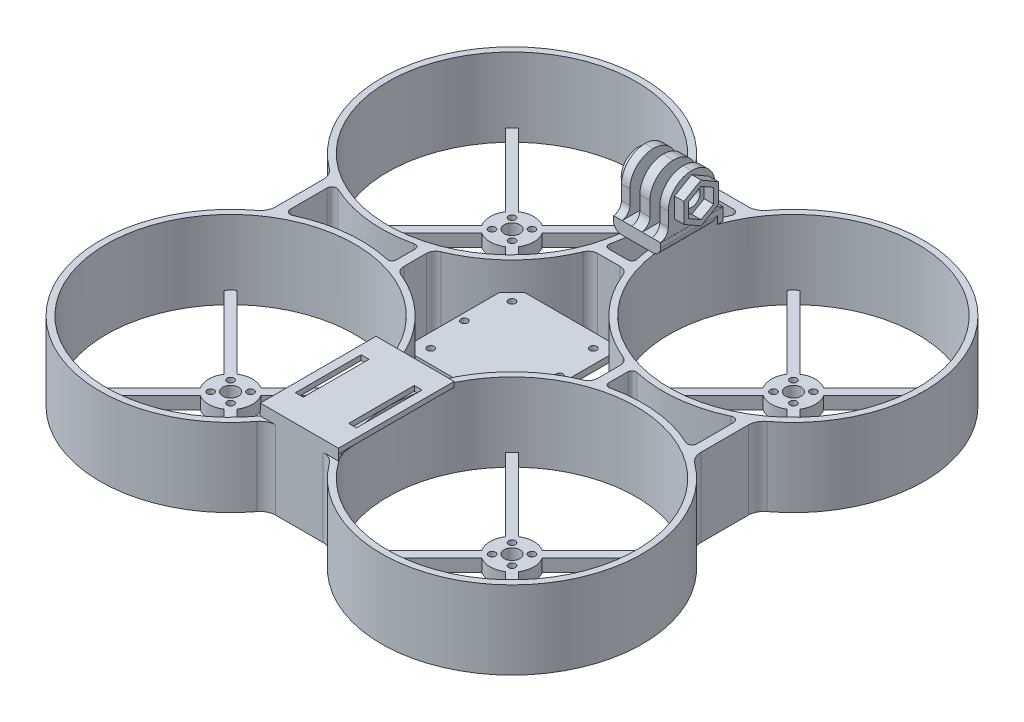
from build123d import *

# Parameters (mm, degrees)
SKETCH1_R               = 7
SKETCH1_R_2             = 1.1
SKETCH1_R_3             = 2.5
BOSS_EXTRUDE3_DEPTH     = 4
BOSS_EXTRUDE3_2_DEPTH   = 4
BOSS_EXTRUDE3_3_DEPTH   = 4
BOSS_EXTRUDE3_4_DEPTH   = 4
SKETCH10_R              = 41.75
SKETCH10_R_2            = 39.75
BOSS_EXTRUDE8_DEPTH     = 25
BOSS_EXTRUDE8_2_DEPTH   = 25
BOSS_EXTRUDE8_3_DEPTH   = 25
BOSS_EXTRUDE8_4_DEPTH   = 25
BOSS_EXTRUDE15_DEPTH    = 25
BOSS_EXTRUDE16_DEPTH    = 4
SKETCH13_R              = 1.1
BOSS_EXTRUDE9_DEPTH     = 2
SKETCH14_W              = 15
SKETCH14_H              = 20
BOSS_EXTRUDE10_DEPTH    = 4
SKETCH15_W              = 3.25
SKETCH15_H              = 15
SKETCH15_W_2            = 2.7
BOSS_EXTRUDE11_DEPTH    = 15
FILLET10_R              = 7.5
CUT_EXTRUDE1_DEPTH      = 12
CUT_EXTRUDE1_DEPTH_BACK = 17
SKETCH16_R              = 2.7
BOSS_EXTRUDE12_START    = 2.1
SKETCH17_R              = 5.5
SKETCH17_R_2            = 2.7
BOSS_EXTRUDE12_DEPTH    = 2.1
BOSS_EXTRUDE17_DEPTH    = 3
FILLET12_R              = 2.5
FILLET11_R              = 3
SKETCH24_W              = 25
SKETCH24_H              = 37
SKETCH24_W_2            = 2.5
SKETCH24_H_2            = 21
BOSS_EXTRUDE18_DEPTH    = 1.6
FILLET14_R              = 5
FILLET15_R              = 1.5
FILLET16_R              = 3
FILLET17_R              = 1.3


# Some blends are built 0.0001 mm under size
with BuildPart() as part:
    # Sketch1 → Boss-Extrude3 (new body)
    with BuildSketch(Plane(origin=(0, 0, 0), x_dir=(1, 0, 0), z_dir=(0, 1, 0))):
        with Locations(Location((-45, 45, 0), (0, 0, 270))):
            Circle(SKETCH1_R)
        with Locations(Location((-48.174434414, 48.189508763, 0), (0, 0, 270))):
            Circle(SKETCH1_R_2, mode=Mode.SUBTRACT)
        with Locations(Location((-41.818028411, 48.181971589, 0), (0, 0, 270))):
            Circle(SKETCH1_R_2, mode=Mode.SUBTRACT)
        with Locations(Location((-41.810491237, 41.825565586, 0), (0, 0, 270))):
            Circle(SKETCH1_R_2, mode=Mode.SUBTRACT)
        with Locations(Location((-48.181971589, 41.818028411, 0), (0, 0, 270))):
            Circle(SKETCH1_R_2, mode=Mode.SUBTRACT)
        with Locations(Location((-45, 45, 0), (0, 0, 270))):
            Circle(SKETCH1_R_3, mode=Mode.SUBTRACT)
    extrude(amount=BOSS_EXTRUDE3_DEPTH)



with BuildPart() as body_2:
    # Sketch1 → Boss-Extrude3 2 (new body)
    with BuildSketch(Plane(origin=(0, 0, 0), x_dir=(1, 0, 0), z_dir=(0, 1, 0))):
        with Locations(Location((45, 45, 0), (0, 0, 270))):
            Circle(SKETCH1_R)
        with Locations(Location((41.818019485, 48.181980515, 0), (0, 0, 270))):
            Circle(SKETCH1_R_2, mode=Mode.SUBTRACT)
        with Locations(Location((48.181980515, 48.181980515, 0), (0, 0, 270))):
            Circle(SKETCH1_R_2, mode=Mode.SUBTRACT)
        with Locations(Location((48.181980515, 41.818019485, 0), (0, 0, 270))):
            Circle(SKETCH1_R_2, mode=Mode.SUBTRACT)
        with Locations(Location((41.818019485, 41.818019485, 0), (0, 0, 270))):
            Circle(SKETCH1_R_2, mode=Mode.SUBTRACT)
        with Locations(Location((45, 45, 0), (0, 0, 270))):
            Circle(SKETCH1_R_3, mode=Mode.SUBTRACT)
    extrude(amount=BOSS_EXTRUDE3_2_DEPTH)


with BuildPart() as body_3:
    # Sketch1 → Boss-Extrude3 3 (new body)
    with BuildSketch(Plane(origin=(0, 0, 0), x_dir=(1, 0, 0), z_dir=(0, 1, 0))):
        with Locations(Location((45, -45, 0), (0, 0, 270))):
            Circle(SKETCH1_R)
        with Locations(Location((41.818019485, -48.181980515, 0), (0, 0, 270))):
            Circle(SKETCH1_R_2, mode=Mode.SUBTRACT)
        with Locations(Location((41.818019485, -41.818019485, 0), (0, 0, 270))):
            Circle(SKETCH1_R_2, mode=Mode.SUBTRACT)
        with Locations(Location((48.181980515, -41.818019485, 0), (0, 0, 270))):
            Circle(SKETCH1_R_2, mode=Mode.SUBTRACT)
        with Locations(Location((48.181980515, -48.181980515, 0), (0, 0, 270))):
            Circle(SKETCH1_R_2, mode=Mode.SUBTRACT)
        with Locations(Location((45, -45, 0), (0, 0, 270))):
            Circle(SKETCH1_R_3, mode=Mode.SUBTRACT)
    extrude(amount=BOSS_EXTRUDE3_3_DEPTH)


with BuildPart() as body_4:
    # Sketch1 → Boss-Extrude3 4 (new body)
    with BuildSketch(Plane(origin=(0, 0, 0), x_dir=(1, 0, 0), z_dir=(0, 1, 0))):
        with Locations(Location((-45, -45, 0), (0, 0, 270))):
            Circle(SKETCH1_R)
        with Locations(Location((-48.181980515, -41.818019485, 0), (0, 0, 270))):
            Circle(SKETCH1_R_2, mode=Mode.SUBTRACT)
        with Locations(Location((-41.818019485, -41.818019485, 0), (0, 0, 270))):
            Circle(SKETCH1_R_2, mode=Mode.SUBTRACT)
        with Locations(Location((-41.818019485, -48.181980515, 0), (0, 0, 270))):
            Circle(SKETCH1_R_2, mode=Mode.SUBTRACT)
        with Locations(Location((-48.181980515, -48.181980515, 0), (0, 0, 270))):
            Circle(SKETCH1_R_2, mode=Mode.SUBTRACT)
        with Locations(Location((-45, -45, 0), (0, 0, 270))):
            Circle(SKETCH1_R_3, mode=Mode.SUBTRACT)
    extrude(amount=BOSS_EXTRUDE3_4_DEPTH)


with BuildPart() as body_5:
    # Sketch10 → Boss-Extrude8 (new body)
    with BuildSketch(Plane(origin=(0, 0, 0), x_dir=(1, 0, 0), z_dir=(0, 1, 0))):
        with Locations(Location((-45, -45, 0), (0, 0, 270))):
            Circle(SKETCH10_R)
        with Locations(Location((-45, -45, 0), (0, 0, 270))):
            Circle(SKETCH10_R_2, mode=Mode.SUBTRACT)
    extrude(amount=BOSS_EXTRUDE8_DEPTH)



with BuildPart() as body_6:
    # Sketch10 → Boss-Extrude8 2 (new body)
    with BuildSketch(Plane(origin=(0, 0, 0), x_dir=(1, 0, 0), z_dir=(0, 1, 0))):
        with Locations(Location((45, -45, 0), (0, 0, 270))):
            Circle(SKETCH10_R)
        with Locations(Location((45, -45, 0), (0, 0, 270))):
            Circle(SKETCH10_R_2, mode=Mode.SUBTRACT)
    extrude(amount=BOSS_EXTRUDE8_2_DEPTH)


with BuildPart() as body_7:
    # Sketch10 → Boss-Extrude8 3 (new body)
    with BuildSketch(Plane(origin=(0, 0, 0), x_dir=(1, 0, 0), z_dir=(0, 1, 0))):
        with Locations(Location((45, 45, 0), (0, 0, 270))):
            Circle(SKETCH10_R)
        with Locations(Location((45, 45, 0), (0, 0, 270))):
            Circle(SKETCH10_R_2, mode=Mode.SUBTRACT)
    extrude(amount=BOSS_EXTRUDE8_3_DEPTH)


with BuildPart() as body_8:
    # Sketch10 → Boss-Extrude8 4 (new body)
    with BuildSketch(Plane(origin=(0, 0, 0), x_dir=(1, 0, 0), z_dir=(0, 1, 0))):
        with Locations(Location((-45, 45, 0), (0, 0, 270))):
            Circle(SKETCH10_R)
        with Locations(Location((-45, 45, 0), (0, 0, 270))):
            Circle(SKETCH10_R_2, mode=Mode.SUBTRACT)
    extrude(amount=BOSS_EXTRUDE8_4_DEPTH)


with BuildPart() as body_5_1:
    add(body_5.part)

    add(body_6.part)  # Boss-Extrude15 merges body 6

    add(body_7.part)  # Boss-Extrude15 merges body 7

    add(body_8.part)  # Boss-Extrude15 merges body 8
    # Sketch21 → Boss-Extrude15 (add)
    with BuildSketch(Plane(origin=(0, 25, 0), x_dir=(1, 0, 0), z_dir=(0, 1, 0))):
        Polygon((-34, 4.725162943), (-34, -4.725162943), (-31, -5.667284609), (-31, 5.667284609), align=None)
        Polygon((-68, 10.156600338), (-68, -10.156600338), (-65, -8.352182875), (-65, 8.352182875), align=None)
        Polygon((-10.156600338, 68), (-8.352182875, 65), (8.352182875, 65), (10.156600338, 68), align=None)
        Polygon((-5.667284609, 31), (-4.725162943, 34), (4.725162943, 34), (5.667284609, 31), align=None)
        Polygon((68, 10.156600338), (65, 8.352182875), (65, -8.352182875), (68, -10.156600338), align=None)
        Polygon((31, 5.667284609), (34, 4.725162943), (34, -4.725162943), (31, -5.667284609), align=None)
        Polygon((10.156600338, -68), (8.352182875, -65), (-8.352182875, -65), (-10.156600338, -68), align=None)
        Polygon((5.667284609, -31), (4.725162943, -34), (-4.725162943, -34), (-5.667284609, -31), align=None)
    extrude(amount=-BOSS_EXTRUDE15_DEPTH)


with BuildPart() as part_1:
    add(part.part)

    add(body_2.part)  # Boss-Extrude16 merges body 2

    add(body_3.part)  # Boss-Extrude16 merges body 3

    add(body_4.part)  # Boss-Extrude16 merges body 4

    add(body_5_1.part)  # Boss-Extrude16 merges body 5
    # Sketch22 → Boss-Extrude16 (add)
    with BuildSketch(Plane(origin=(0, 0, 0), x_dir=(1, 0, 0), z_dir=(0, 1, 0))):
        Polygon((-39.104569927, 41.22589027), (-15.242783205, 17.364103549), (-17.364103549, 15.242783205), (-41.22589027, 39.104569927), align=None)
        Polygon((-48.77410973, 39.104569927), (-50.895430073, 41.22589027), (-74.757216795, 17.364103549), (-72.635896451, 15.242783205), align=None)
        Polygon((-50.895430073, 48.77410973), (-48.77410973, 50.895430073), (-72.635896451, 74.757216795), (-74.757216795, 72.635896451), align=None)
        Polygon((-41.22589027, 50.895430073), (-39.104569927, 48.77410973), (-15.242783205, 72.635896451), (-17.364103549, 74.757216795), align=None)
        Polygon((48.77410973, 50.895430073), (50.895430073, 48.77410973), (74.757216795, 72.635896452), (72.635896451, 74.757216795), align=None)
        Polygon((39.104569927, 48.77410973), (41.22589027, 50.895430073), (17.364103549, 74.757216795), (15.242783205, 72.635896452), align=None)
        Polygon((50.895430073, 41.22589027), (48.77410973, 39.104569927), (72.635896451, 15.242783205), (74.757216795, 17.364103549), align=None)
        Polygon((41.22589027, 39.104569927), (39.104569927, 41.22589027), (15.242783205, 17.364103549), (17.364103549, 15.242783205), align=None)
        Polygon((50.895430073, -48.77410973), (48.77410973, -50.895430073), (72.635896452, -74.757216795), (74.757216795, -72.635896451), align=None)
        Polygon((48.77410973, -39.104569927), (50.895430073, -41.22589027), (74.757216795, -17.364103548), (72.635896452, -15.242783205), align=None)
        Polygon((41.22589027, -50.895430073), (39.104569927, -48.77410973), (15.242783205, -72.635896451), (17.364103549, -74.757216795), align=None)
        Polygon((39.104569927, -41.22589027), (41.22589027, -39.104569927), (17.364103549, -15.242783205), (15.242783205, -17.364103548), align=None)
        Polygon((-48.77410973, -50.895430073), (-50.895430073, -48.77410973), (-74.757216795, -72.635896451), (-72.635896451, -74.757216795), align=None)
        Polygon((-39.104569927, -48.77410973), (-41.22589027, -50.895430073), (-17.364103548, -74.757216795), (-15.242783205, -72.635896451), align=None)
        Polygon((-50.895430073, -41.22589027), (-48.77410973, -39.104569927), (-72.635896451, -15.242783205), (-74.757216795, -17.364103548), align=None)
        Polygon((-41.22589027, -39.104569927), (-39.104569927, -41.22589027), (-15.242783205, -17.364103549), (-17.364103548, -15.242783205), align=None)
    extrude(amount=BOSS_EXTRUDE16_DEPTH)

    # Sketch13 → Boss-Extrude9 (add)
    with BuildSketch(Plane(origin=(0, 14, 0), x_dir=(1, 0, 0), z_dir=(0, 1, 0))):
        with BuildLine():
            Line((-14.5, -17.5), (14.5, -17.5))
            ThreePointArc((14.5, -17.5), (16.621320344, -16.621320344), (17.5, -14.5))
            Line((17.5, -14.5), (17.5, 14.5))
            ThreePointArc((17.5, 14.5), (16.621320344, 16.621320344), (14.5, 17.5))
            Line((14.5, 17.5), (-14.5, 17.5))
            ThreePointArc((-14.5, 17.5), (-16.621320344, 16.621320344), (-17.5, 14.5))
            Line((-17.5, 14.5), (-17.5, -14.5))
            ThreePointArc((-17.5, -14.5), (-16.621320344, -16.621320344), (-14.5, -17.5))
        make_face()
        with Locations(Location((-13, 13, 0), (0, 0, 270))):
            Circle(SKETCH13_R, mode=Mode.SUBTRACT)
        with Locations(Location((13, 13, 0), (0, 0, 270))):
            Circle(SKETCH13_R, mode=Mode.SUBTRACT)
        with Locations(Location((13, -13, 0), (0, 0, 270))):
            Circle(SKETCH13_R, mode=Mode.SUBTRACT)
        with Locations(Location((-13, -13, 0), (0, 0, 270))):
            Circle(SKETCH13_R, mode=Mode.SUBTRACT)
        with Locations(Location((-15.25, 0, 0), (0, 0, 270))):
            Circle(SKETCH13_R, mode=Mode.SUBTRACT)
        with Locations(Location((15.25, 0, 0), (0, 0, 270))):
            Circle(SKETCH13_R, mode=Mode.SUBTRACT)
    extrude(amount=BOSS_EXTRUDE9_DEPTH)

    # Sketch14 → Boss-Extrude10 (add)
    with BuildSketch(Plane(origin=(0, 25, 0), x_dir=(1, 0, 0), z_dir=(0, 1, 0))):
        with Locations((0, 50)):
            Rectangle(SKETCH14_W, SKETCH14_H)
    extrude(amount=BOSS_EXTRUDE10_DEPTH)

    # Sketch15 → Boss-Extrude11 (add)
    with BuildSketch(Plane(origin=(0, 29, 0), x_dir=(1, 0, 0), z_dir=(0, 1, 0))):
        with Locations((0, 50)):
            Rectangle(SKETCH15_W, SKETCH15_H)
        with Locations((-6.125, 50)):
            Rectangle(SKETCH15_W_2, SKETCH15_H)
        with Locations((6.125, 50)):
            Rectangle(SKETCH15_W_2, SKETCH15_H)
    extrude(amount=BOSS_EXTRUDE11_DEPTH)

    # Fillet10
    fillet10_edges = [part_1.edges().sort_by_distance(p)[0] for p in [
        (6.125, 44, -42.5),
        (6.125, 44, -57.5),
        (0, 44, -42.5),
        (0, 44, -57.5),
        (-6.125, 44, -42.5),
        (-6.125, 44, -57.5),
    ]]
    fillet(fillet10_edges, radius=FILLET10_R - 0.0001)  # a hair under: the kernel refuses the full size

    # Sketch16 → Cut-Extrude1 (cut, two sides: drawn at the far end of the back side and taken through both)
    with BuildSketch(Plane.ZY.offset(7.475).offset(-CUT_EXTRUDE1_DEPTH_BACK)):
        with Locations(Location((-50, 36.5, 0), (0, 0, 180))):
            Circle(SKETCH16_R)
    extrude(amount=CUT_EXTRUDE1_DEPTH + CUT_EXTRUDE1_DEPTH_BACK, mode=Mode.SUBTRACT)

    # Sketch17 → Boss-Extrude12 (add)
    with BuildSketch(Plane.ZY.offset(7.475).offset(BOSS_EXTRUDE12_START)):
        with Locations(Location((-50, 36.5, 0), (0, 0, 180))):
            Circle(SKETCH17_R)
        with Locations(Location((-50, 36.5, 0), (0, 0, 180))):
            Circle(SKETCH17_R_2, mode=Mode.SUBTRACT)
    extrude(amount=-BOSS_EXTRUDE12_DEPTH)

    # Sketch23 → Boss-Extrude17 (add)
    with BuildSketch(Plane(origin=(7.475, 0, 0), x_dir=(0, 0, -1), z_dir=(1, 0, 0))):
        Polygon((50, 42.850852961), (44.5, 39.675426481), (44.5, 33.324573519), (50, 30.149147039), (55.5, 33.324573519), (55.5, 39.675426481), align=None)
        Polygon((50, 41.118802154), (46, 38.809401077), (46, 34.190598923), (50, 31.881197846), (54, 34.190598923), (54, 38.809401077), align=None, mode=Mode.SUBTRACT)
    extrude(amount=BOSS_EXTRUDE17_DEPTH)

    # Fillet12
    # the kernel refuses this fillet: 2.5 mm, written as the material it takes off along each edge
    with BuildSketch(Plane(origin=(-7.5, 25, -64.433796873), x_dir=(0, 1, 0), z_dir=(0, 0, 1))) as fillet12_piece_1_section:
        with BuildLine():
            CenterArc((FILLET12_R, -FILLET12_R), FILLET12_R, 90, 90)
            Line((0, -FILLET12_R), (0, 0))
            Line((0, 0), (FILLET12_R, 0))
        make_face()
    fillet12_piece_1 = extrude(amount=30.683796873, mode=Mode.PRIVATE)
    fillet12_piece_1 = fillet12_piece_1 & Plane(origin=(-45, 25.587737679, -45), x_dir=(0, 0, 1), z_dir=(0, -1, 0)) * Cylinder(39.75, 72, mode=Mode.PRIVATE)
    with BuildSketch(Plane(origin=(7.5, 25, -33.75), x_dir=(0, 1, 0), z_dir=(0, 0, -1))) as fillet12_piece_2_section:
        with BuildLine():
            CenterArc((FILLET12_R, -FILLET12_R), FILLET12_R, 90, 90)
            Line((0, -FILLET12_R), (0, 0))
            Line((0, 0), (FILLET12_R, 0))
        make_face()
    fillet12_piece_2 = extrude(amount=30.683796873, mode=Mode.PRIVATE)
    fillet12_piece_2 = fillet12_piece_2 & Plane(origin=(45, 25.587748778, -45), x_dir=(0, 0, 1), z_dir=(0, -1, 0)) * Cylinder(39.75, 72, mode=Mode.PRIVATE)
    add([fillet12_piece_1, fillet12_piece_2], mode=Mode.SUBTRACT)

    # Fillet11
    # the kernel refuses this fillet: 3 mm, written as the material it adds along each edge
    with BuildSketch(Plane(origin=(9.020099729, 29, -57.5), x_dir=(0, 0, -1), z_dir=(-1, 0, 0))) as fillet11_piece_1_section:
        with BuildLine():
            CenterArc((3, -2.958039892), FILLET11_R, 99.594068227, 80.405931773)
            Line((0, -2.958039892), (-0.06, -2.958039892))
            Line((-0.06, -2.958039892), (-0.06, 0))
            Line((-0.06, 0), (0, 0.06))
            ThreePointArc((0, 0.06), (1.25, 0.06), (2.49, 0.059160798))
            Line((2.49, 0.059160798), (2.5, 0))
        make_face()
    fillet11_piece_1 = extrude(amount=10.645099729, mode=Mode.PRIVATE)
    fillet11_piece_1 = split(fillet11_piece_1, bisect_by=Plane(origin=(7.475, 29.68598203, -58.116958935), z_dir=(-1, 0, 0)), keep=Keep.TOP, mode=Mode.PRIVATE)
    fillet11_piece_1 = split(fillet11_piece_1, bisect_by=Plane(origin=(4.775, 29.68598203, -58.116958935), z_dir=(1, 0, 0)), keep=Keep.TOP, mode=Mode.PRIVATE)
    add(fillet11_piece_1)
    with BuildSketch(Plane(origin=(1.625, 29, -57.5), x_dir=(0, 0, -1), z_dir=(-1, 0, 0)), Plane(origin=(-1.625, 29, -42.5), x_dir=(0, 0, 1), z_dir=(1, 0, 0))) as fillet11_piece_2:
        with BuildLine():
            CenterArc((3, -2.958039892), FILLET11_R, 99.594068227, 80.405931773)
            Line((0, -2.958039892), (-0.06, -2.958039892))
            Line((-0.06, -2.958039892), (-0.06, 0))
            Line((-0.06, 0), (0, 0.06))
            ThreePointArc((0, 0.06), (1.25, 0.06), (2.49, 0.059160798))
            Line((2.49, 0.059160798), (2.5, 0))
        make_face()
    extrude(amount=3.25)
    with BuildSketch(Plane(origin=(1.625, 29, -57.5), x_dir=(0, 0, -1), z_dir=(-1, 0, 0))) as fillet11_piece_3_section:
        with BuildLine():
            CenterArc((3, -2.958039892), FILLET11_R, 99.594068227, 80.405931773)
            Line((0, -2.958039892), (-0.06, -2.958039892))
            Line((-0.06, -2.958039892), (-0.06, 0))
            Line((-0.06, 0), (0, 0.06))
            ThreePointArc((0, 0.06), (1.25, 0.06), (2.49, 0.059160798))
            Line((2.49, 0.059160798), (2.5, 0))
        make_face()
    fillet11_piece_3 = extrude(amount=10.645099729, mode=Mode.PRIVATE)
    fillet11_piece_3 = split(fillet11_piece_3, bisect_by=Plane(origin=(-4.775, 29.68598203, -58.116958935), z_dir=(-1, 0, 0)), keep=Keep.TOP, mode=Mode.PRIVATE)
    fillet11_piece_3 = split(fillet11_piece_3, bisect_by=Plane(origin=(-7.475, 29.68598203, -58.116958935), z_dir=(1, 0, 0)), keep=Keep.TOP, mode=Mode.PRIVATE)
    add(fillet11_piece_3)
    with BuildSketch(Plane(origin=(-9.020099729, 29, -42.5), x_dir=(0, 0, 1), z_dir=(1, 0, 0))) as fillet11_piece_4_section:
        with BuildLine():
            CenterArc((3, -2.958039892), FILLET11_R, 99.594068227, 80.405931773)
            Line((0, -2.958039892), (-0.06, -2.958039892))
            Line((-0.06, -2.958039892), (-0.06, 0))
            Line((-0.06, 0), (0, 0.06))
            ThreePointArc((0, 0.06), (1.25, 0.06), (2.49, 0.059160798))
            Line((2.49, 0.059160798), (2.5, 0))
        make_face()
    fillet11_piece_4 = extrude(amount=10.645099729, mode=Mode.PRIVATE)
    fillet11_piece_4 = split(fillet11_piece_4, bisect_by=Plane(origin=(-7.475, 29.68598203, -41.883041065), z_dir=(1, 0, 0)), keep=Keep.TOP, mode=Mode.PRIVATE)
    fillet11_piece_4 = split(fillet11_piece_4, bisect_by=Plane(origin=(-4.775, 29.68598203, -41.883041065), z_dir=(-1, 0, 0)), keep=Keep.TOP, mode=Mode.PRIVATE)
    add(fillet11_piece_4)
    with BuildSketch(Plane(origin=(-1.625, 29, -42.5), x_dir=(0, 0, 1), z_dir=(1, 0, 0))) as fillet11_piece_5_section:
        with BuildLine():
            CenterArc((3, -2.958039892), FILLET11_R, 99.594068227, 80.405931773)
            Line((0, -2.958039892), (-0.06, -2.958039892))
            Line((-0.06, -2.958039892), (-0.06, 0))
            Line((-0.06, 0), (0, 0.06))
            ThreePointArc((0, 0.06), (1.25, 0.06), (2.49, 0.059160798))
            Line((2.49, 0.059160798), (2.5, 0))
        make_face()
    fillet11_piece_5 = extrude(amount=10.645099729, mode=Mode.PRIVATE)
    fillet11_piece_5 = split(fillet11_piece_5, bisect_by=Plane(origin=(7.475, 29.68598203, -41.883041065), z_dir=(-1, 0, 0)), keep=Keep.TOP, mode=Mode.PRIVATE)
    fillet11_piece_5 = split(fillet11_piece_5, bisect_by=Plane(origin=(4.775, 29.68598203, -41.883041065), z_dir=(1, 0, 0)), keep=Keep.TOP, mode=Mode.PRIVATE)
    add(fillet11_piece_5)
    with BuildSketch(Plane(origin=(2.620099729, 29, -57.5), x_dir=(0, 1, 0), z_dir=(-1, 0, 0))) as fillet11_piece_6_section:
        with BuildLine():
            CenterArc((2.958039892, 3), FILLET11_R, 189.594068227, 80.405931773)
            Line((0, 2.5), (-0.059160798, 2.49))
            ThreePointArc((-0.059160798, 2.49), (-0.06, 1.25), (-0.06, 0))
            Line((-0.06, 0), (0, -0.06))
            Line((0, -0.06), (2.958039892, -0.06))
            Line((2.958039892, -0.06), (2.958039892, 0))
        make_face()
    fillet11_piece_6 = extrude(amount=10.095099729, mode=Mode.PRIVATE)
    fillet11_piece_6 = split(fillet11_piece_6, bisect_by=Plane(origin=(-1.625, 29.68598203, -58.116958935), z_dir=(1, 0, 0)), keep=Keep.TOP, mode=Mode.PRIVATE)
    fillet11_piece_6 = split(fillet11_piece_6, bisect_by=Plane(origin=(1.625, 29.68598203, -58.116958935), z_dir=(-1, 0, 0)), keep=Keep.TOP, mode=Mode.PRIVATE)
    add(fillet11_piece_6)
    with BuildSketch(Plane(origin=(-4.775, 29, -57.5), x_dir=(0, 1, 0), z_dir=(-1, 0, 0)), Plane(origin=(-7.475, 29, -42.5), x_dir=(0, 1, 0), z_dir=(1, 0, 0))) as fillet11_piece_7:
        with BuildLine():
            CenterArc((2.958039892, 3), FILLET11_R, 189.594068227, 80.405931773)
            Line((0, 2.5), (-0.059160798, 2.49))
            ThreePointArc((-0.059160798, 2.49), (-0.06, 1.25), (-0.06, 0))
            Line((-0.06, 0), (0, -0.06))
            Line((0, -0.06), (2.958039892, -0.06))
            Line((2.958039892, -0.06), (2.958039892, 0))
        make_face()
    extrude(amount=2.7)
    with BuildSketch(Plane(origin=(-7.475, 29, -42.5), x_dir=(0, 1, 0), z_dir=(1, 0, 0))) as fillet11_piece_8_section:
        with BuildLine():
            CenterArc((2.958039892, 3), FILLET11_R, 189.594068227, 80.405931773)
            Line((0, 2.5), (-0.059160798, 2.49))
            ThreePointArc((-0.059160798, 2.49), (-0.06, 1.25), (-0.06, 0))
            Line((-0.06, 0), (0, -0.06))
            Line((0, -0.06), (2.958039892, -0.06))
            Line((2.958039892, -0.06), (2.958039892, 0))
        make_face()
    fillet11_piece_8 = extrude(amount=10.095099729, mode=Mode.PRIVATE)
    fillet11_piece_8 = split(fillet11_piece_8, bisect_by=Plane(origin=(-1.625, 29.68598203, -41.883041065), z_dir=(1, 0, 0)), keep=Keep.TOP, mode=Mode.PRIVATE)
    fillet11_piece_8 = split(fillet11_piece_8, bisect_by=Plane(origin=(1.625, 29.68598203, -41.883041065), z_dir=(-1, 0, 0)), keep=Keep.TOP, mode=Mode.PRIVATE)
    add(fillet11_piece_8)
    with BuildSketch(Plane(origin=(7.475, 29, -57.5), x_dir=(0, 0, -1), z_dir=(-1, 0, 0)), Plane(origin=(4.775, 29, -42.5), x_dir=(0, 0, 1), z_dir=(1, 0, 0))) as fillet11_piece_9:
        with BuildLine():
            CenterArc((3, -2.958039892), FILLET11_R, 99.594068227, 80.405931773)
            Line((0, -2.958039892), (-0.06, -2.958039892))
            Line((-0.06, -2.958039892), (-0.06, 0))
            Line((-0.06, 0), (0, 0.06))
            ThreePointArc((0, 0.06), (1.25, 0.06), (2.49, 0.059160798))
            Line((2.49, 0.059160798), (2.5, 0))
        make_face()
    extrude(amount=2.7)
    with BuildSketch(Plane(origin=(7.475, 29, -57.5), x_dir=(0, 0, -1), z_dir=(-1, 0, 0))) as fillet11_piece_10_section:
        with BuildLine():
            CenterArc((3, -2.958039892), FILLET11_R, 99.594068227, 80.405931773)
            Line((0, -2.958039892), (-0.06, -2.958039892))
            Line((-0.06, -2.958039892), (-0.06, 0))
            Line((-0.06, 0), (0, 0.06))
            ThreePointArc((0, 0.06), (1.25, 0.06), (2.49, 0.059160798))
            Line((2.49, 0.059160798), (2.5, 0))
        make_face()
    fillet11_piece_10 = extrude(amount=10.095099729, mode=Mode.PRIVATE)
    fillet11_piece_10 = split(fillet11_piece_10, bisect_by=Plane(origin=(-1.625, 29.68598203, -58.116958935), z_dir=(1, 0, 0)), keep=Keep.TOP, mode=Mode.PRIVATE)
    fillet11_piece_10 = split(fillet11_piece_10, bisect_by=Plane(origin=(1.625, 29.68598203, -58.116958935), z_dir=(-1, 0, 0)), keep=Keep.TOP, mode=Mode.PRIVATE)
    add(fillet11_piece_10)
    with BuildSketch(Plane(origin=(-2.620099729, 29, -42.5), x_dir=(0, 0, 1), z_dir=(1, 0, 0))) as fillet11_piece_11_section:
        with BuildLine():
            CenterArc((3, -2.958039892), FILLET11_R, 99.594068227, 80.405931773)
            Line((0, -2.958039892), (-0.06, -2.958039892))
            Line((-0.06, -2.958039892), (-0.06, 0))
            Line((-0.06, 0), (0, 0.06))
            ThreePointArc((0, 0.06), (1.25, 0.06), (2.49, 0.059160798))
            Line((2.49, 0.059160798), (2.5, 0))
        make_face()
    fillet11_piece_11 = extrude(amount=10.095099729, mode=Mode.PRIVATE)
    fillet11_piece_11 = split(fillet11_piece_11, bisect_by=Plane(origin=(-1.625, 29.68598203, -41.883041065), z_dir=(1, 0, 0)), keep=Keep.TOP, mode=Mode.PRIVATE)
    fillet11_piece_11 = split(fillet11_piece_11, bisect_by=Plane(origin=(1.625, 29.68598203, -41.883041065), z_dir=(-1, 0, 0)), keep=Keep.TOP, mode=Mode.PRIVATE)
    add(fillet11_piece_11)



with BuildPart() as body_2_2:
    # Sketch24 → Boss-Extrude18 (new body)
    with BuildSketch(Plane(origin=(0, 27, 0), x_dir=(1, 0, 0), z_dir=(0, 1, 0))):
        with Locations((0, -49.5)):
            Rectangle(SKETCH24_W, SKETCH24_H)
        with Locations((-8.5, -49)):
            Rectangle(SKETCH24_W_2, SKETCH24_H_2, mode=Mode.SUBTRACT)
        with Locations((8.5, -49)):
            Rectangle(SKETCH24_W_2, SKETCH24_H_2, mode=Mode.SUBTRACT)
    extrude(amount=BOSS_EXTRUDE18_DEPTH)


with BuildPart() as part_2:
    add(part_1.part)

    add(body_2_2.part)  # Loft1 merges body 2 2
    # Sketch25 for Loft1 → Loft1 section 0
    with BuildSketch(Plane(origin=(0, 25, 0), x_dir=(1, 0, 0), z_dir=(0, 1, 0))):
        with BuildLine():
            Line((-7.797009529, -31), (7.797009529, -31))
            # circular arc as an exact rational Bezier (weights 1, cos(half-angle), 1)
            Bezier((7.797009529, -31), (7.239985279, -32.480211989), (6.802323369, -34), weights=[1, 0.999209418, 1])
            Line((6.802323369, -34), (-6.802323369, -34))
            Bezier((-6.802323369, -34), (-7.239985279, -32.480211989), (-7.797009529, -31), weights=[1, 0.999209418, 1])
        make_face()
    # Sketch26 → Loft1 section 1
    with BuildSketch(Plane.XZ.offset(-27)):
        with BuildLine():
            Line((-12.5, 31), (12.5, 31))
            Line((12.5, 31), (12.5, 36.195))
            Line((12.5, 36.195), (-12.5, 36.195))
            Line((-12.5, 36.195), (-12.5, 31))
        make_face()
    loft()

    # Sketch27 for Loft2 → Loft2 section 0
    with BuildSketch(Plane(origin=(0, 25, 0), x_dir=(1, 0, 0), z_dir=(0, 1, 0))):
        with BuildLine():
            Line((-12.579905922, -68), (12.579905922, -68))
            Bezier((12.579905922, -68), (11.546540683, -66.543400075), (10.647962215, -65), weights=[1, 0.998992221, 1])
            Line((10.647962215, -65), (-10.647962215, -65))
            Bezier((-10.647962215, -65), (-11.546540683, -66.543400075), (-12.579905922, -68), weights=[1, 0.998992221, 1])
        make_face()
    # Sketch28 → Loft2 section 1
    with BuildSketch(Plane.XZ.offset(-27)):
        with BuildLine():
            Line((12.5, 68), (-12.5, 68))
            Line((-12.5, 68), (-12.5, 63.348211555))
            Line((-12.5, 63.348211555), (12.5, 63.348211555))
            Line((12.5, 63.348211555), (12.5, 68))
        make_face()
    loft()

    # Fillet14
    fillet14_edges = [part_2.edges().sort_by_distance(p)[0] for p in [
        (-68, 12.5, 10.156600338),
        (-68, 12.5, -10.156600338),
        (10.156600338, 12.5, -68),
        (-10.156600338, 12.5, -68),
        (-10.156600338, 12.5, 68),
        (10.156600338, 12.5, 68),
        (68, 12.5, 10.156600338),
        (68, 12.5, -10.156600338),
    ]]
    fillet(fillet14_edges, radius=FILLET14_R)

    # Fillet15
    fillet15_edges = [part_2.edges().sort_by_distance(p)[0] for p in [
        (65, 12.5, -8.352182875),
        (65, 12.5, 8.352182875),
        (8.352182875, 12.5, -65),
        (-8.352182875, 12.5, -65),
        (-65, 12.5, -8.352182875),
        (-65, 12.5, 8.352182875),
        (8.352182875, 12.5, 65),
        (-8.352182875, 12.5, 65),
    ]]
    fillet(fillet15_edges, radius=FILLET15_R)

    # Fillet16
    fillet16_edges = [part_2.edges().sort_by_distance(p)[0] for p in [
        (-31, 12.5, -5.667284609),
        (-31, 12.5, 5.667284609),
        (-5.667284609, 12.5, -31),
        (5.667284609, 12.5, -31),
        (31, 12.5, -5.667284609),
        (31, 12.5, 5.667284609),
        (5.667284609, 12.5, 31),
        (-5.667284609, 12.5, 31),
    ]]
    fillet(fillet16_edges, radius=FILLET16_R)

    # Fillet17
    fillet17_edges = [part_2.edges().sort_by_distance(p)[0] for p in [
        (34, 12.5, -4.725162943),
        (34, 12.5, 4.725162943),
        (4.725162943, 12.5, -34),
        (-4.725162943, 12.5, -34),
        (-34, 12.5, -4.725162943),
        (-34, 12.5, 4.725162943),
        (4.725162943, 12.5, 34),
        (-4.725162943, 12.5, 34),
    ]]
    fillet(fillet17_edges, radius=FILLET17_R)


solid = part_2.part
